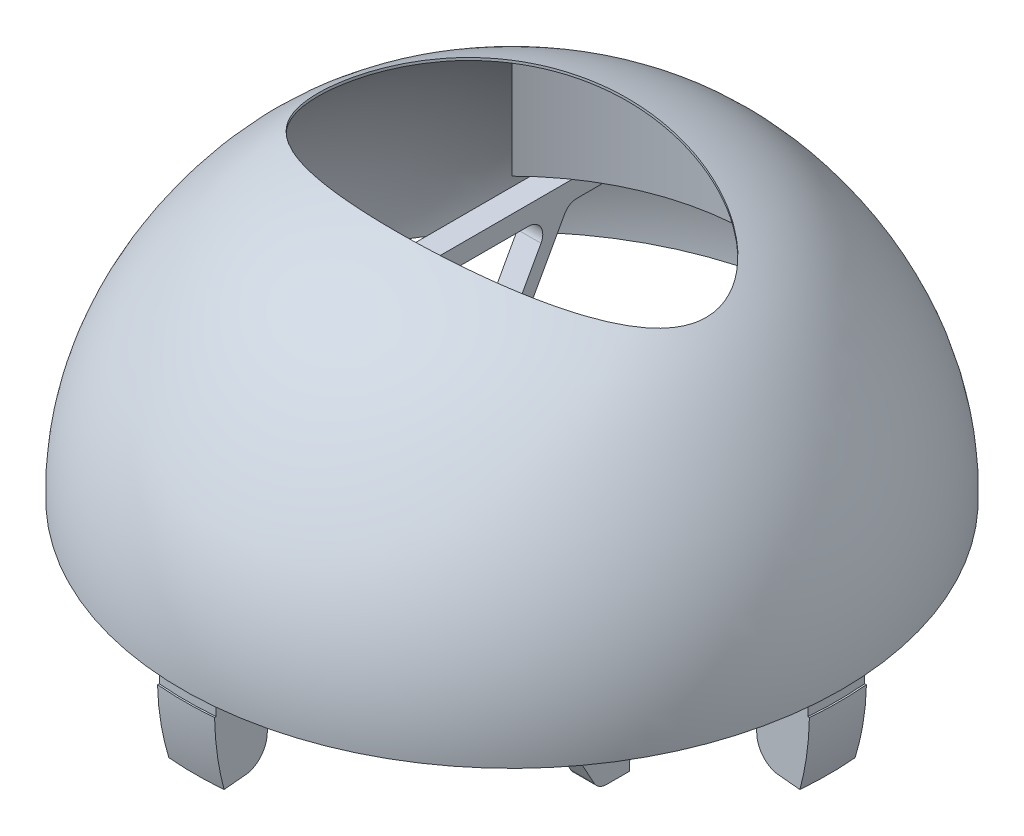
from build123d import *

# Parameters (mm, degrees)
ROTATION_D_NN1_OUTLINE_W        = 0.113188128
ROTATION_D_NN1_OUTLINE_H        = 1
ROTATION_D_NN1_OUTLINE_W_2      = 29.886811872
SKIZZE2_RX                      = 82.455867631
SKIZZE2_RY                      = 49.027813186
SCHNITT_LINEAR_AUSTRAGEN1_DEPTH = 202
ROTATION2_ANGLE                 = 5
ROTATION2_OTHER_WAY_ANGLE       = 5
VERRUNDUNG1_R                   = 10
KREISMUSTER2_COUNT              = 4
ROTATION3_ANGLE                 = 90
AUFSATZ_LINEAR_START            = 70
AUFSATZ_LINEAR_AUSTRAGEN1_DEPTH = 10
SKIZZE7_R                       = 2.85
SCHNITT_LINEAR_AUSTRAGEN2_DEPTH = 8
VERRUNDUNG3_R                   = 6
VERRUNDUNG5_R                   = 3
SKIZZE10_R                      = 2.75
SCHNITT_LINEAR_AUSTRAGEN4_DEPTH = 10
SKIZZE11_R                      = 3.3
SCHNITT_LINEAR_AUSTRAGEN5_DEPTH = 10


with BuildPart() as part:
    # Rotation-Dünn1: read off the stored shape, not the designer's step
    # Rotation-Dünn1 outline → Rotation-Dünn1 (revolve)
    with BuildSketch(Plane.XY):
        with BuildLine():
            Line((30, 127), (29.886811872, 127))
            add(Edge.make_bspline(
                [(29.886811872, 127), (29.924538025, 126.991342103), (29.962267412, 126.982676498), (30, 126.97400316)],
                knots=[0, 0, 0, 0, 0.000648386, 0.000648386, 0.000648386, 0.000648386], degree=3))
            Line((30, 126.97400316), (30, 127))
        make_face()
        with Locations((29.943405936, 127.5)):
            Rectangle(ROTATION_D_NN1_OUTLINE_W, ROTATION_D_NN1_OUTLINE_H)
        with Locations((14.943405936, 127.5)):
            Rectangle(ROTATION_D_NN1_OUTLINE_W_2, ROTATION_D_NN1_OUTLINE_H)
        with BuildLine():
            Line((30, 127), (30, 126.97400316))
            add(Edge.make_bspline(
                [(30, 126.97400316), (44.510930435, 123.638472658), (59.495176103, 119.159470388), (76.380216283, 110.552780869), (79.671165399, 108.677112642), (84.422549965, 105.608187262), (85.975511888, 104.542641875), (89.012296056, 102.321504936), (90.49517076, 101.165037475), (97.739385685, 95.156031588), (102.99272173, 89.639702729), (109.009496988, 82.247417665), (110.185400974, 80.744102894), (112.48523463, 77.697900025), (113.608562564, 76.155497402), (116.893290722, 71.472522119), (118.969431326, 68.276183218), (124.813040843, 58.481166274), (128.195628137, 51.67655385), (135.731724357, 32.424575519), (138.61688744, 19.516320947), (139.000412177, 6.138810058)],
                knots=[0.000648386, 0.000648386, 0.000648386, 0.000648386, 0.25, 0.25, 0.3125, 0.3125, 0.34375, 0.34375, 0.375, 0.375, 0.5, 0.5, 0.53125, 0.53125, 0.5625, 0.5625, 0.625, 0.625, 0.75, 0.75, 0.967115187, 0.967115187, 0.967115187, 0.967115187], degree=3))
            Line((139.000412177, 6.138810058), (139.000412177, 18.082835303))
            add(Edge.make_bspline(
                [(34.231854255, 127), (53.794868782, 122.23046394), (84.406099271, 111.53658079), (121.145862461, 71.531144113), (135.852614284, 40.724022307), (139.000412177, 18.082835303)],
                knots=[0.024087618, 0.024087618, 0.024087618, 0.024087618, 0.357284479, 0.530346239, 0.902596657, 0.902596657, 0.902596657, 0.902596657], degree=3))
            Line((34.231854255, 127), (30, 127))
        make_face()
        with BuildLine():
            Line((30, 128), (30, 127))
            Line((30, 127), (34.231854255, 127))
            add(Edge.make_bspline(
                [(30, 128), (31.406389392, 127.677746239), (32.817595948, 127.344801461), (34.231854255, 127)],
                knots=[0, 0, 0, 0, 0.024087618, 0.024087618, 0.024087618, 0.024087618], degree=3))
        make_face()
        with BuildLine():
            Line((139.000412177, 18.082835303), (139.000412177, 6.138810058))
            add(Edge.make_bspline(
                [(139.000412177, 6.138810058), (139.0585018, 4.112618545), (139.059201601, 2.075661872), (139.000412177, 0.028708614)],
                knots=[0.967115187, 0.967115187, 0.967115187, 0.967115187, 1, 1, 1, 1], degree=3))
            Line((139.000412177, 0.028708614), (140, 0.028708614))
            Line((140, 0.028708614), (140, 6.165779952))
            add(Edge.make_bspline(
                [(139.000412177, 18.082835303), (139.546235838, 14.156885796), (139.884849944, 10.18249532), (140, 6.165779952)],
                knots=[0.902596657, 0.902596657, 0.902596657, 0.902596657, 0.967144348, 0.967144348, 0.967144348, 0.967144348], degree=3))
        make_face()
        Polygon((140, 0.028708614), (139.000412177, 0.028708614), (140, 0), align=None)
        with BuildLine():
            Line((140, 0.028708614), (140, 0))
            add(Edge.make_bspline(
                [(140.000820677, 0.028708614), (140.000548407, 0.019139294), (140.000274848, 0.009569756), (140, 0)],
                knots=[0.999847789, 0.999847789, 0.999847789, 0.999847789, 1, 1, 1, 1], degree=3))
            Line((140.000820677, 0.028708614), (140, 0.028708614))
        make_face()
        with BuildLine():
            Line((140, 6.165779952), (140, 0.028708614))
            Line((140, 0.028708614), (140.000820677, 0.028708614))
            add(Edge.make_bspline(
                [(140.044228074, 3.081473717), (140.044228082, 2.066428849), (140.029845016, 1.048808097), (140.000820677, 0.028708614)],
                knots=[0.983621934, 0.983621934, 0.983621934, 0.983621934, 0.999847789, 0.999847789, 0.999847789, 0.999847789], degree=3))
            add(Edge.make_bspline(
                [(140, 6.165779952), (140.02939524, 5.140402132), (140.044228066, 4.112266139), (140.044228074, 3.081473717)],
                knots=[0.967144348, 0.967144348, 0.967144348, 0.967144348, 0.983621934, 0.983621934, 0.983621934, 0.983621934], degree=3))
        make_face()
    revolve(axis=Axis((0, 0, 0), (0, 1, 0)))

    # Skizze2 → Schnitt-Linear austragen1 (cut)
    with BuildSketch(Plane(origin=(0, 0, 0), x_dir=(1, 0, 0), z_dir=(0, 1, 0))):
        with Locations(Location((0, 0), (0, 0, 180))):
            Ellipse(SKIZZE2_RX, SKIZZE2_RY)
    extrude(amount=SCHNITT_LINEAR_AUSTRAGEN1_DEPTH, mode=Mode.SUBTRACT)


with BuildPart() as body_2:
    # Skizze3 → Rotation2 (revolve)
    with BuildSketch(Plane.XY):
        with BuildLine():
            Line((114.317680997, -0.063589627), (138.207613279, -0.063589627))
            Line((138.207613279, -0.063589627), (138.207613279, 4.936410373))
            Line((138.207613279, 4.936410373), (138.907613279, 4.936410373))
            Line((138.907613279, 4.936410373), (138.922761106, 4.936410373))
            add(Edge.make_bspline(
                [(138.922761106, 4.936410373), (138.906769562, 5.900015381), (138.801633114, 9.491794989), (138.049395211, 18.301828769), (136.376209286, 26.96866651), (134.737846198, 32.923272774), (134.483925439, 33.806365862)],
                knots=[0.065449115, 0.065449115, 0.065449115, 0.065449115, 0.112422115, 0.240625597, 0.497032561, 0.541856638, 0.541856638, 0.541856638, 0.541856638], degree=3))
            Line((134.483925439, 33.806365862), (114.317680997, 33.806365862))
            Line((114.317680997, 33.806365862), (114.317680997, -0.063589627))
        make_face()
    revolve(axis=Axis((0, 0, 0), (0, 1, 0)), revolution_arc=ROTATION2_ANGLE)

    # Skizze3 → Rotation2 other way (revolve)
    with BuildSketch(Plane.XY):
        with BuildLine():
            Line((114.317680997, -0.063589627), (138.207613279, -0.063589627))
            Line((138.207613279, -0.063589627), (138.207613279, 4.936410373))
            Line((138.207613279, 4.936410373), (138.907613279, 4.936410373))
            Line((138.907613279, 4.936410373), (138.922761106, 4.936410373))
            add(Edge.make_bspline(
                [(138.922761106, 4.936410373), (138.906769562, 5.900015381), (138.801633114, 9.491794989), (138.049395211, 18.301828769), (136.376209286, 26.96866651), (134.737846198, 32.923272774), (134.483925439, 33.806365862)],
                knots=[0.065449115, 0.065449115, 0.065449115, 0.065449115, 0.112422115, 0.240625597, 0.497032561, 0.541856638, 0.541856638, 0.541856638, 0.541856638], degree=3))
            Line((134.483925439, 33.806365862), (114.317680997, 33.806365862))
            Line((114.317680997, 33.806365862), (114.317680997, -0.063589627))
        make_face()
    revolve(axis=Axis((0, 0, 0), (0, -1, 0)), revolution_arc=ROTATION2_OTHER_WAY_ANGLE)

    # Spiegeln4: body 2 across plane


with BuildPart() as body_2_1:
    add(body_2.part)
    add(body_2.part.mirror(Plane(origin=(113.882667707, -0.063589627, -9.963442396), x_dir=(0, 0, 1), z_dir=(0, -1, 0))))

    # Verrundung1
    verrundung1_edges = [body_2_1.edges().sort_by_distance(p)[0] for p in [
        (114.317680997, 33.806365862, 0),
        (114.317680997, -33.933545115, 0),
    ]]
    fillet(verrundung1_edges, radius=VERRUNDUNG1_R)


with BuildPart() as kreismuster2_1:
    # Kreismuster2: pattern copy
    add(body_2_1.part.rotate(Axis((0, 0, 0), (0, 1, 0)), 1 * 360 / KREISMUSTER2_COUNT))


with BuildPart() as kreismuster2_2:
    # Kreismuster2: pattern copy
    add(body_2_1.part.rotate(Axis((0, 0, 0), (0, 1, 0)), 2 * 360 / KREISMUSTER2_COUNT))


with BuildPart() as kreismuster2_3:
    # Kreismuster2: pattern copy
    add(body_2_1.part.rotate(Axis((0, 0, 0), (0, 1, 0)), 3 * 360 / KREISMUSTER2_COUNT))


with BuildPart() as body_6:
    # Rotation3: read off the stored shape, not the designer's step
    # Rotation3 outline → Rotation3 (revolve)
    with BuildSketch(Plane(origin=(0, 0, 0), x_dir=(-0.7071067811865487, 0, 0.7071067811865464), z_dir=(-0.7071067811865464, 0, -0.7071067811865487))):
        with BuildLine():
            add(Edge.make_bspline(
                [(101.724363158, 90.705880995), (102.372756746, 90.013366853), (104.452584749, 87.739455115), (108.922766086, 82.483518553), (114.815348174, 74.666058596), (122.16589577, 63.357275355), (127.047555467, 53.954463064), (129.697312902, 47.731388322), (130.057908774, 46.858228013)],
                knots=[0.449640376, 0.449640376, 0.449640376, 0.449640376, 0.465255521, 0.500315372, 0.56277595, 0.625236529, 0.721379743, 0.736994887, 0.736994887, 0.736994887, 0.736994887], degree=3))
            Line((101.724363158, 90.705880995), (101.724363158, 46.858228013))
            Line((101.724363158, 46.858228013), (130.057908774, 46.858228013))
        make_face()
    revolve(axis=Axis((0, 0, 0), (0, 1, 0)), revolution_arc=ROTATION3_ANGLE)

    # Skizze11 → Schnitt-Linear austragen5 (cut)
    with BuildSketch(Plane.XZ.offset(-46.858228013)):
        with Locations(Location((65, 94.607316068, 0), (0, 0, 270))):
            Circle(SKIZZE11_R)
        with Locations(Location((-65, 94.607316068, 0), (0, 0, 270))):
            Circle(SKIZZE11_R)
    extrude(amount=-SCHNITT_LINEAR_AUSTRAGEN5_DEPTH, mode=Mode.SUBTRACT)


with BuildPart() as body_7:
    # Skizze4<6> → Aufsatz-Linear austragen1 (new body)
    with BuildSketch(Plane.ZY.offset(AUFSATZ_LINEAR_START)):
        Polygon((26, -45), (0, -45), (0, -51), (20, -51), (20, -55), (33.390525676, -55), (84.085003443, 36.858228013), (100.607316068, 36.858228013), (100.607316068, 44.858228013), (26, 44.858228013), align=None)
        Polygon((77.231940556, 36.858228013), (32, -45.101900428), (32, 36.858228013), align=None, mode=Mode.SUBTRACT)
    aufsatz_linear_austragen1 = extrude(amount=-AUFSATZ_LINEAR_AUSTRAGEN1_DEPTH)

    # Skizze7 → Schnitt-Linear austragen2 (cut)
    with BuildSketch(Plane.XZ.offset(-36.858228013)):
        with Locations(Location((-65, 94.607316068, 0), (0, 0, 270))):
            Circle(SKIZZE7_R)
    schnitt_linear_austragen2 = extrude(amount=-SCHNITT_LINEAR_AUSTRAGEN2_DEPTH, mode=Mode.SUBTRACT)

    # Spiegeln10: Aufsatz-Linear austragen1, Schnitt-Linear austragen2 across plane
    add(aufsatz_linear_austragen1.mirror(Plane.XY))
    add(schnitt_linear_austragen2.mirror(Plane.XY), mode=Mode.SUBTRACT)

    # Verrundung3
    verrundung3_edges = [body_7.edges().sort_by_distance(p)[0] for p in [
        (-65, -55, 33.390525676),
        (-65, 36.858228013, 84.085003443),
        (-65, 36.858228013, 77.231940556),
        (-65, -45.101900428, 32),
        (-65, 36.858228013, 32),
        (-65, -55, -33.390525676),
        (-65, 36.858228013, -84.085003443),
        (-65, 36.858228013, -32),
        (-65, 36.858228013, -77.231940556),
        (-65, -45.101900428, -32),
    ]]
    fillet(verrundung3_edges, radius=VERRUNDUNG3_R)

    # Verrundung5
    verrundung5_edges = [body_7.edges().sort_by_distance(p)[0] for p in [
        (-70, 40.858228013, 100.607316068),
        (-65, -45, 26),
        (-60, 40.858228013, 100.607316068),
        (-65, -45, -26),
        (-60, 40.858228013, -100.607316068),
        (-70, 40.858228013, -100.607316068),
    ]]
    fillet(verrundung5_edges, radius=VERRUNDUNG5_R)

    # Skizze10 → Schnitt-Linear austragen4 (cut)
    with BuildSketch(Plane.XZ.offset(51)):
        with Locations(Location((-65, 0, 0), (0, 0, 270))):
            Circle(SKIZZE10_R)
    extrude(amount=-SCHNITT_LINEAR_AUSTRAGEN4_DEPTH, mode=Mode.SUBTRACT)


with BuildPart() as body_8:
    # Spiegeln18: mirrored copy
    add(body_7.part.mirror(Plane(origin=(0, 0, 0), x_dir=(0, 0, 1), z_dir=(1, 0, 0))))


with BuildPart() as body_9:
    # Spiegeln21: mirrored copy
    add(body_6.part.mirror(Plane.XY))


solid = Compound([part.part, body_2_1.part, kreismuster2_1.part, kreismuster2_2.part, kreismuster2_3.part, body_6.part, body_7.part, body_8.part, body_9.part])
